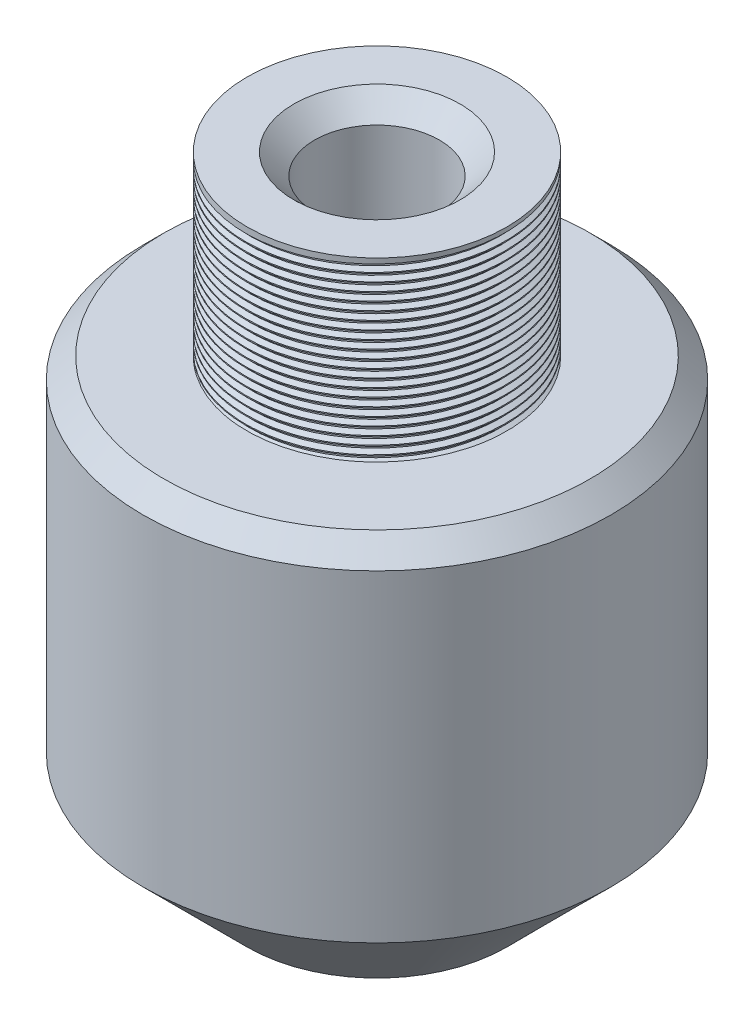
from build123d import *

# Parameters (mm, degrees)
THREAD_1_PITCH = 0.8


with BuildPart() as part:
    # Sketch 1 → Повернуть1 (revolve)
    with BuildSketch(Plane.XY, mode=Mode.PRIVATE) as revolve_1_sk:
        Polygon((6, -28), (6, 28), (8, 30), (12.5, 30), (12.5, 13), (20.5, 13), (22.5, 11), (22.5, -20), (12.5, -30), (8, -30), align=None)
    revolve(revolve_1_sk.sketch.rotate(Axis((0, 0, 0), (0, -1, 0)), 180), axis=Axis((0, 0, 0), (0, -1, 0)))

    # Резьба1: the profile of Sketch 1 2 profile screwed along a right-hand helix of 21.25 turns, 8 arcs to a turn; built about Z, then put on its axis
    thread_1_z = Axis((0, 0, 0), (0, 0, 1))
    thread_1_corners = [(12.5003, 0, -0.000173205), (12.5003, 0, 0.700173203), (12.0669873, 0, 0.449999999), (12.0669873, 0, 0.249999999)]
    with BuildLine(mode=Mode.PRIVATE) as thread_1_profile:
        Line(thread_1_corners[0], thread_1_corners[1])
        Line(thread_1_corners[1], thread_1_corners[2])
        Line(thread_1_corners[2], thread_1_corners[3])
        Line(thread_1_corners[3], thread_1_corners[0])
    thread_1_cap = Face(thread_1_profile.wire())
    thread_1_turn_angles = [0, 22.5, 45, 67.5, 90, 112.5, 135, 157.5, 180, 202.5, 225, 247.5, 270, 292.5, 315, 337.5, 360]
    thread_1_turn_weights = [1, 0.9238795325112867, 1, 0.9238795325112867, 1, 0.9238795325112867, 1, 0.9238795325112867, 1, 0.9238795325112867, 1, 0.9238795325112867, 1, 0.9238795325112867, 1, 0.9238795325112867, 1]
    thread_1_turn_rails = [Edge.make_bspline([Vector(p[0], p[1], 0).rotate(thread_1_z, thread_1_turn_angles[k]) / thread_1_turn_weights[k] + Vector(0, 0, p[2] + THREAD_1_PITCH * thread_1_turn_angles[k] / 360) for k in range(17)], [0, 0, 0, 1, 1, 2, 2, 3, 3, 4, 4, 5, 5, 6, 6, 7, 7, 8, 8, 8], 2, thread_1_turn_weights) for p in thread_1_corners]
    thread_1_turn_sides = [Face.make_surface_from_curves(thread_1_turn_rails[p[0]], thread_1_turn_rails[p[1]]) for p in [(0, 1), (1, 2), (2, 3), (3, 0)]]
    thread_1_last_angles = [7560, 7582.5, 7605, 7627.5, 7650]
    thread_1_last_weights = [1, 0.9238795325112867, 1, 0.9238795325112867, 1]
    thread_1_last_rails = [Edge.make_bspline([Vector(p[0], p[1], 0).rotate(thread_1_z, thread_1_last_angles[k]) / thread_1_last_weights[k] + Vector(0, 0, p[2] + THREAD_1_PITCH * thread_1_last_angles[k] / 360) for k in range(5)], [0, 0, 0, 1, 1, 2, 2, 2], 2, thread_1_last_weights) for p in thread_1_corners]
    thread_1_last_sides = [Face.make_surface_from_curves(thread_1_last_rails[p[0]], thread_1_last_rails[p[1]]) for p in [(0, 1), (1, 2), (2, 3), (3, 0)]]
    thread_1 = Plane(origin=(0, 30, 0), x_dir=(-1, 0, 0), z_dir=(0, -1, 0)) * Solid(Shell([*[p.moved(Location((0, 0, THREAD_1_PITCH * i))) for i in range(21) for p in thread_1_turn_sides], *thread_1_last_sides, thread_1_cap, thread_1_cap.rotate(thread_1_z, 7650).moved(Location((0, 0, THREAD_1_PITCH * 7650 / 360)))]))
    add(thread_1, mode=Mode.SUBTRACT)


solid = part.part
